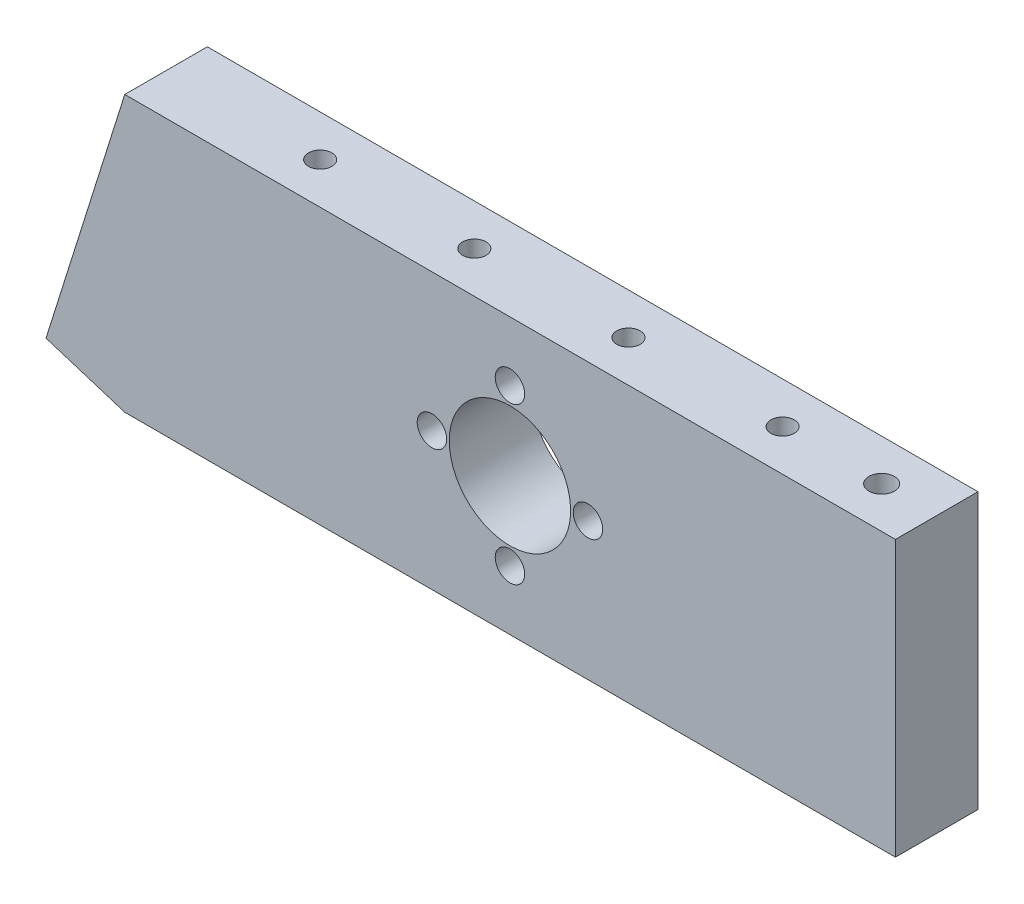
from build123d import *

# Parameters (mm, degrees)
SKETCH1_R           = 1.7
SKETCH1_R_2         = 7
BOSS_EXTRUDE1_DEPTH = 9.525
LPATTERN1_COUNT     = 4
LPATTERN1_PITCH     = 17.78
SKETCH13_R          = 1.4732
CUT_EXTRUDE1_DEPTH  = 12.7


with BuildPart() as part:
    # Sketch1 → Boss-Extrude1 (new body)
    with BuildSketch(Plane.XY):
        Polygon((-44.432958233, 15.875), (44.467041767, 15.875), (44.467041767, -15.875), (-44.432958233, -15.875), (-53.519229126, -13.0175), align=None)
        with Locations((0, -9)):
            Circle(SKETCH1_R, mode=Mode.SUBTRACT)
        with Locations((-9, 0)):
            Circle(SKETCH1_R, mode=Mode.SUBTRACT)
        with Locations((0, 9)):
            Circle(SKETCH1_R, mode=Mode.SUBTRACT)
        with Locations((9, 0)):
            Circle(SKETCH1_R, mode=Mode.SUBTRACT)
        Circle(SKETCH1_R_2, mode=Mode.SUBTRACT)
    extrude(amount=BOSS_EXTRUDE1_DEPTH)

    # Sketch12 → Tap Drill for #6-32 Tap1 (revolve, cut)
    with BuildSketch(Plane(origin=(26.687041767, -15.875, 4.7625), x_dir=(0, 0, -1), z_dir=(1, 0, 0))):
        Polygon((0, 0), (0, 13.51269403), (1.35255, 12.7), (1.35255, 0), align=None)
    tap_drill_for_6_32_tap1 = revolve(axis=Axis((26.687041767, -22.225, 4.7625), (0, 1, 0)), mode=Mode.SUBTRACT)

    # LPattern1: Tap Drill for #6-32 Tap1 ×4
    with Locations(*[(-i * LPATTERN1_PITCH, 0, 0) for i in range(1, LPATTERN1_COUNT)]):
        add(tap_drill_for_6_32_tap1, mode=Mode.SUBTRACT)

    # Mirror8: Tap Drill for #6-32 Tap1 across plane
    add(tap_drill_for_6_32_tap1.mirror(Plane.ZX), mode=Mode.SUBTRACT)

    # Mirror8 copy 1 sketch → Mirror8 copy 1 (revolve, cut)
    with BuildSketch(Plane(origin=(8.907041767, 15.875, 4.7625), x_dir=(0, 0, -1), z_dir=(1, 0, 0))):
        Polygon((0, 0), (0, -13.51269403), (1.35255, -12.7), (1.35255, 0), align=None)
    revolve(axis=Axis((8.907041767, 22.225, 4.7625), (0, 1, 0)), mode=Mode.SUBTRACT)

    # Mirror8 copy 2 sketch → Mirror8 copy 2 (revolve, cut)
    with BuildSketch(Plane(origin=(-8.872958233, 15.875, 4.7625), x_dir=(0, 0, -1), z_dir=(1, 0, 0))):
        Polygon((0, 0), (0, -13.51269403), (1.35255, -12.7), (1.35255, 0), align=None)
    revolve(axis=Axis((-8.872958233, 22.225, 4.7625), (0, 1, 0)), mode=Mode.SUBTRACT)

    # Mirror8 copy 3 sketch → Mirror8 copy 3 (revolve, cut)
    with BuildSketch(Plane(origin=(-26.652958233, 15.875, 4.7625), x_dir=(0, 0, -1), z_dir=(1, 0, 0))):
        Polygon((0, 0), (0, -13.51269403), (1.35255, -12.7), (1.35255, 0), align=None)
    revolve(axis=Axis((-26.652958233, 22.225, 4.7625), (0, 1, 0)), mode=Mode.SUBTRACT)

    # Sketch13 → Cut-Extrude1 (cut)
    with BuildSketch(Plane.XZ.offset(15.875)):
        with Locations((38.117041767, 4.7625)):
            Circle(SKETCH13_R)
    cut_extrude1 = extrude(amount=-CUT_EXTRUDE1_DEPTH, mode=Mode.SUBTRACT)

    # Mirror9: Cut-Extrude1 across plane
    add(cut_extrude1.mirror(Plane.ZX), mode=Mode.SUBTRACT)


solid = part.part
